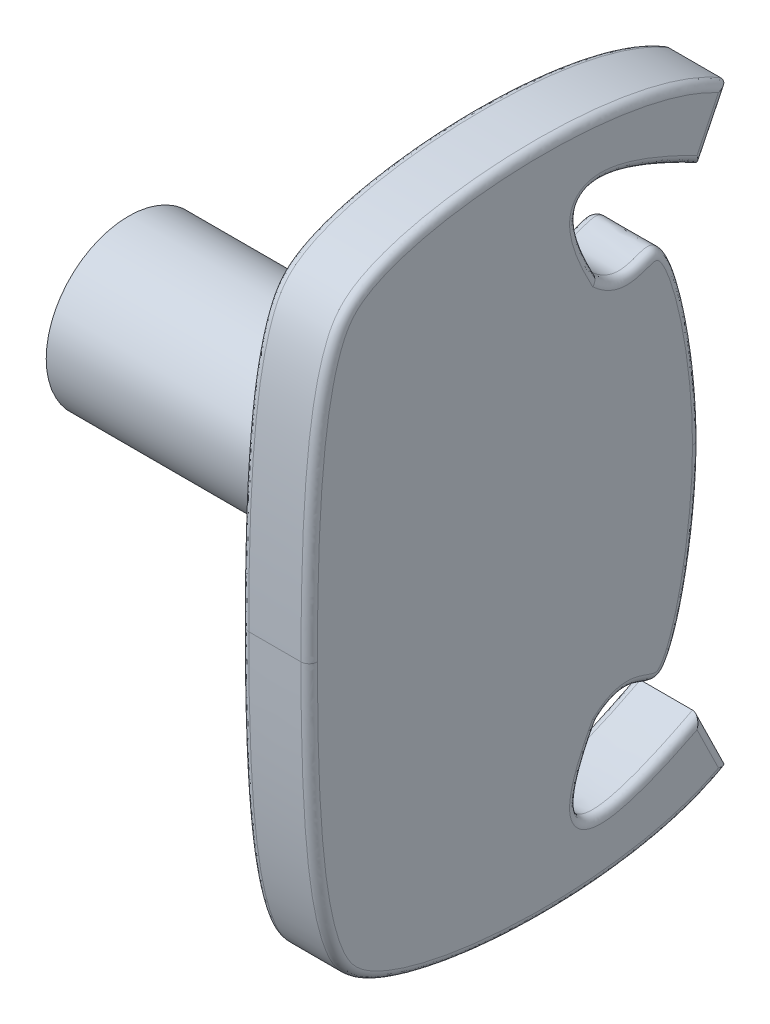
from build123d import *

# Parameters (mm, degrees)
ESTRUSIONE_ESTRUSIONE2_DEPTH = 25
RACCORDO3_R                  = 3
SCHIZZO3_R                   = 30
ESTRUSIONE_ESTRUSIONE3_DEPTH = 120
RACCORDO4_R                  = 10


with BuildPart() as part:
    # Schizzo2 → Estrusione-Estrusione2 (new body)
    with BuildSketch(Plane.YZ):
        with BuildLine():
            Line((-107.704187, -18.148353), (-86.545258, -7.783368))
            add(Edge.make_bspline(
                [(-86.545258, -7.783368), (-119.485134, 55.65647), (-70.075695, 29.216746)],
                knots=[0, 0, 0, 1, 1, 1], degree=2))
            add(Edge.make_bspline(
                [(-70.075695, 29.216746), (-58.761237, 16.405922), (-87.83771, 4.656492), (-27.071245, -7.783368), (0, -7.783368)],
                knots=[0, 0, 0, 0, 0.484242, 1, 1, 1, 1], degree=3))
            Line((0, -7.783368), (0, 134.870466))
            add(Edge.make_bspline(
                [(-107.704187, -18.148353), (-128.592408, 15.816829), (-123.91157, 108.91651), (-89.027269, 131.329701), (-49.769501, 134.870466), (0, 134.870466)],
                knots=[0, 0, 0, 0, 0.555712, 0.655712, 1, 1, 1, 1], degree=3))
        make_face()
    extrude(amount=ESTRUSIONE_ESTRUSIONE2_DEPTH)

    # Specchia1: part across plane


with BuildPart() as part_1:
    add(part.part)
    add(part.part.mirror(Plane.ZX))

    # Raccordo3
    raccordo3_edges = [part_1.edges().sort_by_distance(p)[0] for p in [
        (0, -97.124722, -12.965861),
        (25, -97.124722, -12.965861),
        (0, -114.038733, 104.525292),
        (25, -114.038733, 104.525292),
        (0, -99.682959, 27.360304),
        (25, -99.682959, 27.360304),
        (0, -46.754718, -2.399467),
        (0, 46.754718, -2.399467),
        (0, 99.682959, 27.360304),
        (0, 97.124722, -12.965861),
        (0, 114.038733, 104.525292),
        (25, -46.754718, -2.399467),
        (25, 46.754718, -2.399467),
        (25, 99.682959, 27.360304),
        (25, 97.124722, -12.965861),
        (25, 114.038733, 104.525292),
    ]]
    fillet(raccordo3_edges, radius=RACCORDO3_R)

    # Schizzo3 → Estrusione-Estrusione3 (add)
    with BuildSketch(Plane(origin=(0, 0, 0), x_dir=(0, -1, 0), z_dir=(-1, 0, 0))):
        with Locations(Location((0, 55.652245, 0), (0, 0, 270))):
            Circle(SCHIZZO3_R)
    extrude(amount=ESTRUSIONE_ESTRUSIONE3_DEPTH)

    # Raccordo4
    raccordo4_edges = [part_1.edges().sort_by_distance(p)[0] for p in [
        (0, 0, 85.652245),
    ]]
    fillet(raccordo4_edges, radius=RACCORDO4_R)


solid = part_1.part
